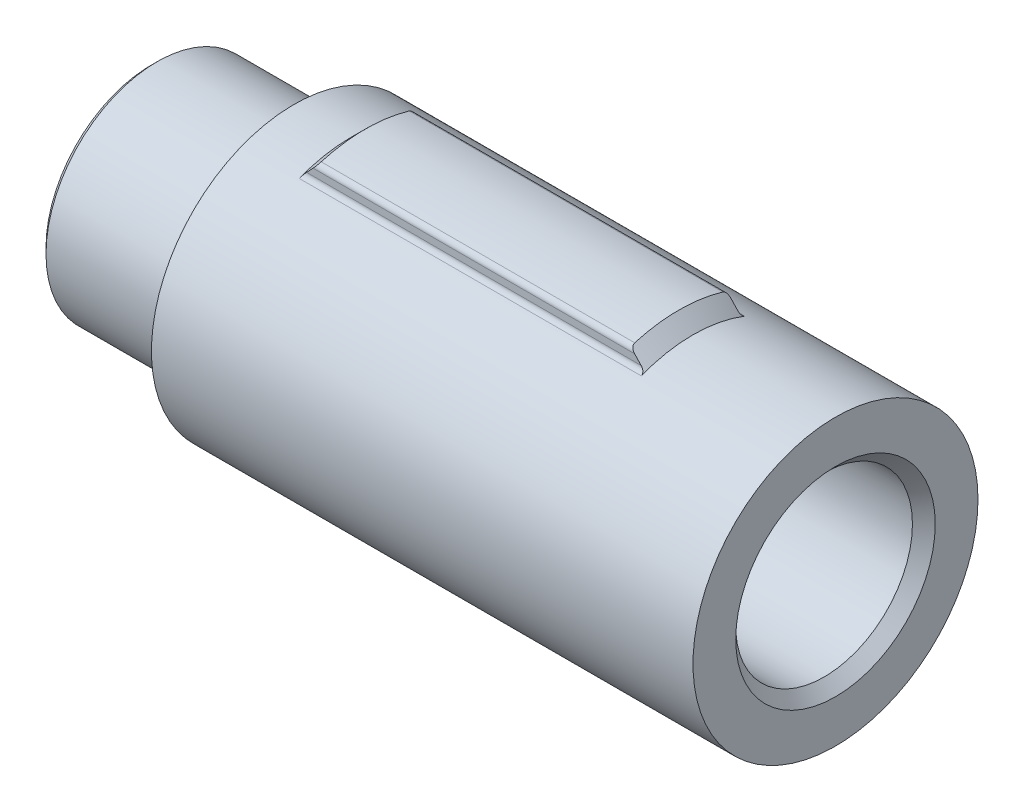
from build123d import *

# Parameters (mm, degrees)
SKETCH_1_R          = 5
EXTRUDE_1_DEPTH     = 19
SKETCH_3_R          = 3.1
CUT_EXTRUDE_1_DEPTH = 17
EXTRUDE_2_DEPTH     = 12
SKETCH_8_R          = 3.9
EXTRUDE_4_DEPTH     = 5
SKETCH_9_R          = 2.8
CUT_EXTRUDE_2_DEPTH = 5
EXTRUDE_5_DEPTH     = 3.2
FILLET_1_R          = 0.2
CHAMFER_1_SIZE      = 0.5
CHAMFER_2_SIZE      = 0.4
CHAMFER_3_SIZE      = 0.2


with BuildPart() as part:
    # 草图1 → 凸台-拉伸1 (new body)
    with BuildSketch(Plane(origin=(0, 0, 0), x_dir=(0, 0, -1), z_dir=(1, 0, 0))):
        Circle(SKETCH_1_R)
    extrude(amount=EXTRUDE_1_DEPTH)

    # 草图3 → 切除-拉伸1 (cut)
    with BuildSketch(Plane(origin=(19, 0, 0), x_dir=(0, 0, -1), z_dir=(1, 0, 0))):
        Circle(SKETCH_3_R)
    extrude(amount=-CUT_EXTRUDE_1_DEPTH, mode=Mode.SUBTRACT)

    # 草图5 → 凸台-拉伸2 (add)
    with BuildSketch(Plane(origin=(2, 0, 0), x_dir=(0, 0, -1), z_dir=(1, 0, 0))):
        with BuildLine():
            Line((-1.688194302, 2.6), (1.688194302, 2.6))
            Line((1.688194302, 2.6), (1.688194302, 5.234500931))
            ThreePointArc((1.688194302, 5.234500931), (0, 5.5), (-1.688194302, 5.234500931))
            Line((-1.688194302, 5.234500931), (-1.688194302, 2.6))
        make_face()
    extrude(amount=EXTRUDE_2_DEPTH)

    # 草图8 → 凸台-拉伸4 (add)
    with BuildSketch(Plane.ZY):
        Circle(SKETCH_8_R)
    extrude(amount=EXTRUDE_4_DEPTH)

    # 草图9 → 切除-拉伸2 (cut)
    with BuildSketch(Plane.ZY.offset(5)):
        Circle(SKETCH_9_R)
    extrude(amount=-CUT_EXTRUDE_2_DEPTH, mode=Mode.SUBTRACT)

    # 草图10 → 凸台-拉伸5 (add)
    with BuildSketch(Plane.ZY):
        Polygon((0.692820323, 1.2), (-0.692820323, 1.2), (-1.385640646, 0), (-0.692820323, -1.2), (0.692820323, -1.2), (1.385640646, 0), align=None)
    extrude(amount=EXTRUDE_5_DEPTH)

    # 圆角1
    fillet_1_edges = [part.edges().sort_by_distance(p)[0] for p in [
        (8, 4.70637865, 1.688194302),
        (8, 5.234500931, 1.688194302),
        (8, 4.70637865, -1.688194302),
        (8, 5.234500931, -1.688194302),
    ]]
    fillet(fillet_1_edges, radius=FILLET_1_R)

    # 倒角1
    # the kernel refuses this chamfer: 0.5 mm, written as the material it takes off along each edge
    with BuildSketch(Plane(origin=(14, 0, 0), x_dir=(0, 0.8686030413593419, -0.4955085837211114), z_dir=(0, -0.4955085837211114, -0.8686030413593419))) as chamfer_1_piece_1:
        Polygon((5.5, -CHAMFER_1_SIZE), (5.5 - CHAMFER_1_SIZE, 0), (5.5, 0), align=None)
    revolve(axis=Axis((14, 0, 0), (1, 0, 0)), revolution_arc=59.40658503, mode=Mode.SUBTRACT)
    with BuildSketch(Plane(origin=(2, 0, 0), x_dir=(0, 0.8686030413593415, -0.4955085837211117), z_dir=(0, -0.4955085837211117, -0.8686030413593415))) as chamfer_1_piece_2:
        Polygon((5.5 - CHAMFER_1_SIZE, 0), (5.5, CHAMFER_1_SIZE), (5.5, 0), align=None)
    revolve(axis=Axis((2, 0, 0), (1, 0, 0)), revolution_arc=59.40658503, mode=Mode.SUBTRACT)
    with BuildSketch(Plane(origin=(14, 2.6, 2.974035796), x_dir=(0.027495876610585623, 0.9996219169112968, 0), z_dir=(0, 0, -1))) as chamfer_1_piece_3_section:
        Polygon((CHAMFER_1_SIZE * 0.999621916911, -CHAMFER_1_SIZE * 0.0274958766106), (-CHAMFER_1_SIZE * 0.0274958766106, -CHAMFER_1_SIZE * 0.999621916911), (0, 0), align=None)
    chamfer_1_piece_3 = extrude(amount=5.948071591, mode=Mode.PRIVATE)
    chamfer_1_piece_3 = chamfer_1_piece_3 & Plane(origin=(13.821912141, 0, 0), x_dir=(0, 0, -1), z_dir=(1, 0, 0)) * Cylinder(3.1, 14, mode=Mode.PRIVATE)
    add(chamfer_1_piece_3, mode=Mode.SUBTRACT)

    # 倒角2
    chamfer_2_edges = [part.edges().sort_by_distance(p)[0] for p in [
        (19, 0, 3.1),
    ]]
    chamfer(chamfer_2_edges, length=CHAMFER_2_SIZE)

    # 倒角3
    chamfer_3_edges = [part.edges().sort_by_distance(p)[0] for p in [
        (-5, 0, -3.9),
        (-5, 0, -2.8),
        (-3.2, 0.6, 1.039230485),
        (-3.2, 1.2, 0),
        (-3.2, 0.6, -1.039230485),
        (-3.2, -0.6, -1.039230485),
        (-3.2, -1.2, 0),
        (-3.2, -0.6, 1.039230485),
    ]]
    chamfer(chamfer_3_edges, length=CHAMFER_3_SIZE)


solid = part.part
